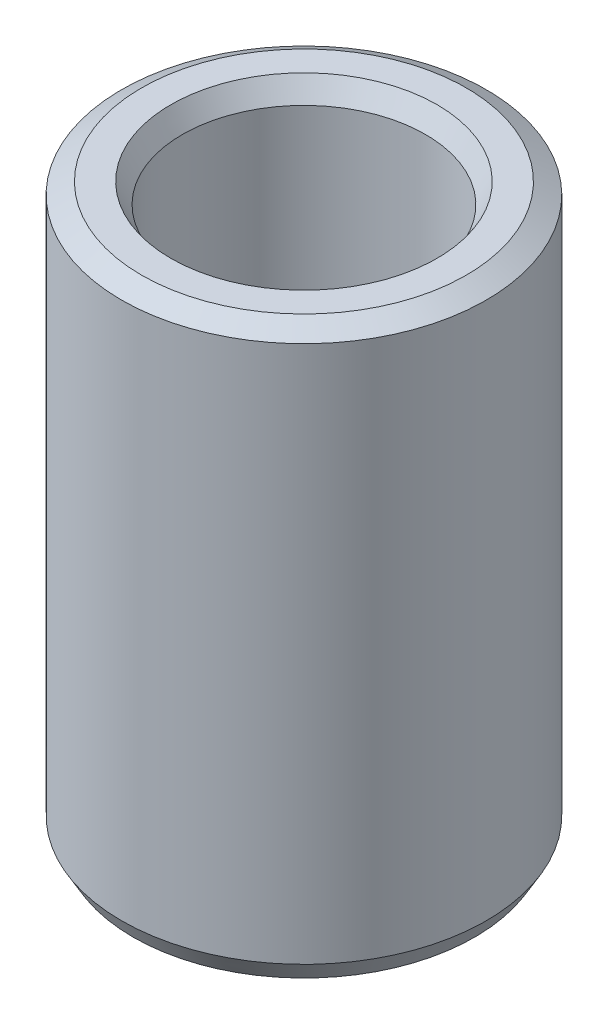
from build123d import *
from OCP.BRepFilletAPI import BRepFilletAPI_MakeChamfer

# Parameters (mm, degrees)
SKETCH1_R           = 17.5
BOSS_EXTRUDE1_DEPTH = 54.624570907
SKETCH2_R           = 11.669520104
CUT_EXTRUDE1_DEPTH  = 60.969523483
CHAMFER1_SIZE       = 1.109513272
CHAMFER1_SIZE2      = 1.921733359


with BuildPart() as part:
    # Sketch1 → Boss-Extrude1 (new body)
    with BuildSketch(Plane(origin=(0, 0, 0), x_dir=(1, 0, 0), z_dir=(0, 1, 0))):
        Circle(SKETCH1_R)
    extrude(amount=BOSS_EXTRUDE1_DEPTH)

    # Sketch2 → Cut-Extrude1 (cut, through all)
    with BuildSketch(Plane(origin=(0, 0, 0), x_dir=(1, 0, 0), z_dir=(0, 1, 0))):
        Circle(SKETCH2_R)
    extrude(amount=CUT_EXTRUDE1_DEPTH, mode=Mode.SUBTRACT)

    # Chamfer1: one chamfer whose edges measure the first distance from different faces: ONE call of the kernel's chamfer builder (chamfer() names one face for all edges)
    chamfer1_edges_1 = [part.edges().sort_by_distance(p)[0] for p in [
        (-11.669520104, 54.624570907, 0),
    ]]
    chamfer1_side_1 = [part.faces().sort_by_distance(p)[0] for p in [
        (-17.005025253, 54.624570907, 0),
    ]]
    chamfer1_edges_2 = [part.edges().sort_by_distance(p)[0] for p in [
        (-11.669520104, 0, 0),
    ]]
    chamfer1_side_2 = [part.faces().sort_by_distance(p)[0] for p in [
        (-11.669520104, 27.312285454, 0),
    ]]
    chamfer1_edges_3 = [part.edges().sort_by_distance(p)[0] for p in [
        (-17.5, 0, 0),
    ]]
    chamfer1_side_3 = [part.faces().sort_by_distance(p)[0] for p in [
        (-17.005025253, 0, 0),
    ]]
    chamfer1_edges_4 = [part.edges().sort_by_distance(p)[0] for p in [
        (-17.5, 54.624570907, 0),
    ]]
    chamfer1_side_4 = [part.faces().sort_by_distance(p)[0] for p in [
        (-17.5, 27.312285454, 0),
    ]]
    chamfer1 = BRepFilletAPI_MakeChamfer(part.part.solid().wrapped)
    for e in chamfer1_edges_1:
        chamfer1.Add(CHAMFER1_SIZE, CHAMFER1_SIZE2, e.wrapped, chamfer1_side_1[0].wrapped)  # the first distance lies on this face
    for e in chamfer1_edges_2:
        chamfer1.Add(CHAMFER1_SIZE, CHAMFER1_SIZE2, e.wrapped, chamfer1_side_2[0].wrapped)  # the first distance lies on this face
    for e in chamfer1_edges_3:
        chamfer1.Add(CHAMFER1_SIZE, CHAMFER1_SIZE2, e.wrapped, chamfer1_side_3[0].wrapped)  # the first distance lies on this face
    for e in chamfer1_edges_4:
        chamfer1.Add(CHAMFER1_SIZE, CHAMFER1_SIZE2, e.wrapped, chamfer1_side_4[0].wrapped)  # the first distance lies on this face
    add(Compound.cast(chamfer1.Shape()), mode=Mode.REPLACE)


solid = part.part
